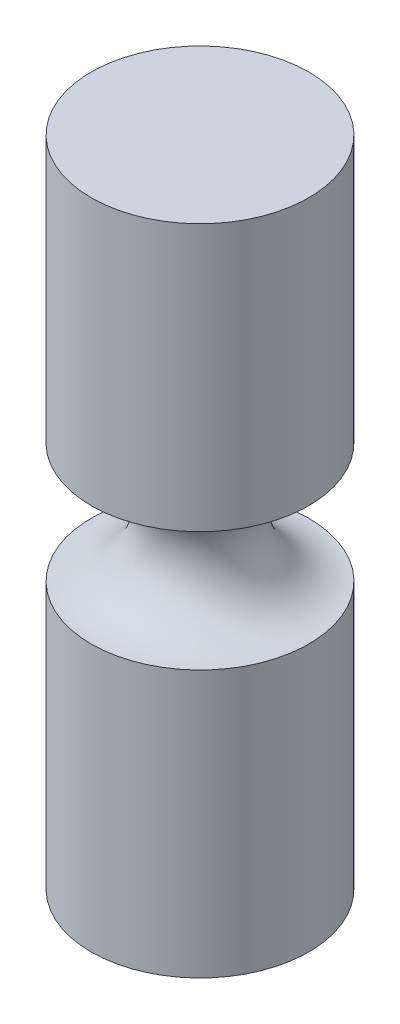
from build123d import *

# Parameters (mm, degrees)
SKETCH1_R           = 10
BOSS_EXTRUDE1_DEPTH = 30


# Read off the part's stored shape, not the designer's step: Cut-Sweep5
with BuildPart() as part:
    # Sketch1 → Boss-Extrude1 (new body)
    with BuildSketch(Plane(origin=(0, 0, 0), x_dir=(1, 0, 0), z_dir=(0, 1, 0))):
        with Locations(Location((0, 0, 0), (0, 0, 270))):
            Circle(SKETCH1_R)
    extrude(amount=BOSS_EXTRUDE1_DEPTH)

    # Cut-Sweep5 outline → Cut-Sweep5 (revolve, cut)
    with BuildSketch(Plane.XY):
        with BuildLine():
            Line((10, 30), (4.5, 30))
            ThreePointArc((4.5, 30), (6.110912703, 26.110912703), (10, 24.5))
            Line((10, 24.5), (10, 30))
        make_face()
    revolve(axis=Axis((0, 0, 0), (0, 1, 0)), mode=Mode.SUBTRACT)

    # Mirror1: part across plane


with BuildPart() as part_1:
    add(part.part)
    add(part.part.mirror(Plane.ZX.offset(30)))


solid = part_1.part
